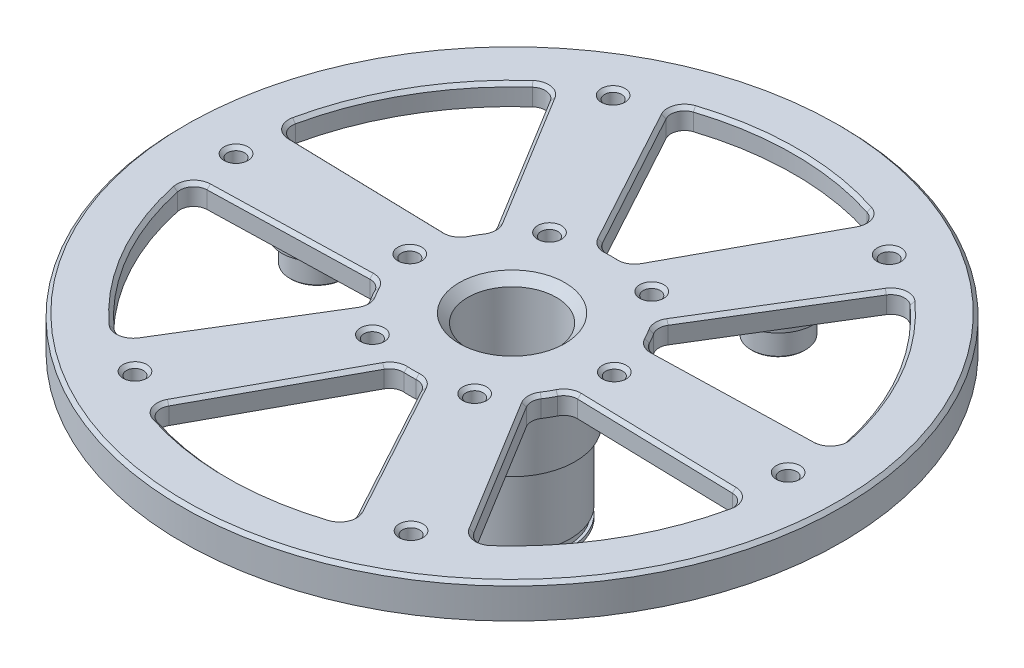
from build123d import *

# Parameters (mm, degrees)
SKETCH2_W                                     = 0.75
SKETCH2_H                                     = 12.25
CIRPATTERN2_COUNT                             = 3
CHAMFER1_SIZE                                 = 1.25
M3X0_5_TAPPED_HOLE_60_MM_DIAMETER_D           = 2.5
M3X0_5_TAPPED_HOLE_60_MM_DIAMETER_CSINK_D     = 3.5
M3X0_5_TAPPED_HOLE_60_MM_DIAMETER_CSINK_ANGLE = 90
CIRPATTERN3_COUNT                             = 6
CUT_EXTRUDE1_DEPTH                            = 72.270295355
CIRPATTERN4_COUNT                             = 6
CHAMFER2_SIZE                                 = 0.5
CHAMFER3_SIZE                                 = 0.5
SKETCH14_W                                    = 6.551993776
SKETCH14_H                                    = 1.1
CHAMFER4_SIZE                                 = 0.5
CHAMFER5_SIZE                                 = 0.2


with BuildPart() as part:
    # Sketch1 → Shaft (revolve)
    with BuildSketch(Plane.XY):
        Polygon((-6.5, 18.1), (-6.5, -1.95), (-4.5, -1.95), (-4.5, -3.95), (-6.6, -3.95), (-6.6, -6.45), (-8.5, -6.45), (-8.5, 18.1), align=None)
    revolve(axis=Axis((0, 0, 0), (0, -1, 0)))

    # Sketch2 → Revolve1 (revolve)
    with BuildSketch(Plane.XY):
        with Locations((-8.875, 11.975)):
            Rectangle(SKETCH2_W, SKETCH2_H)
    revolve(axis=Axis((0, 0, 0), (0, 1, 0)))



with BuildPart() as body_2:
    # Sketch4 → Revolve2 (revolve)
    with BuildSketch(Plane.XY):
        Polygon((-28.599, 12), (-28.599, 18.1), (-33.799, 18.1), (-33.799, 16), (-32.599, 16), (-32.599, 12), align=None)
    revolve(axis=Axis((-28.599, 12.136274552, 0), (0, -1, 0)))


with BuildPart() as cirpattern2_1:
    # CirPattern2: pattern copy
    add(body_2.part.rotate(Axis((0, 0, 0), (0, 1, 0)), 1 * 360 / CIRPATTERN2_COUNT))


with BuildPart() as cirpattern2_2:
    # CirPattern2: pattern copy
    add(body_2.part.rotate(Axis((0, 0, 0), (0, 1, 0)), 2 * 360 / CIRPATTERN2_COUNT))


with BuildPart() as part_1:
    add(part.part)

    add(body_2.part)  # Revolve3 merges body 2

    add(cirpattern2_1.part)  # Revolve3 merges CirPattern2_1

    add(cirpattern2_2.part)  # Revolve3 merges CirPattern2_2
    # Sketch8 → Revolve3 (revolve)
    with BuildSketch(Plane.XY):
        Polygon((-48.35, 20.1), (-6.5, 20.1), (-6.5, 17.1), (-42.519999369, 17.1), (-42.519999369, 18.1), (-47.35, 18.1), (-47.35, 15.15), (-48.35, 15.15), align=None)
    revolve(axis=Axis((0, 0, 0), (0, 1, 0)))

    # Chamfer1
    chamfer1_edges = [part_1.edges().sort_by_distance(p)[0] for p in [
        (6.5, 20.1, 0),
    ]]
    chamfer(chamfer1_edges, length=CHAMFER1_SIZE)

    # M3x0.5 Tapped Hole - 60 mm diameter (through all)
    with Locations(Plane(origin=(0, 20.1, 0), x_dir=(1, 0, 0), z_dir=(0, 1, 0))):
        with Locations((-15, 0), (-40.5, 0)):
            m3x0_5_tapped_hole_60_mm_diameter = CounterSinkHole(M3X0_5_TAPPED_HOLE_60_MM_DIAMETER_D / 2, M3X0_5_TAPPED_HOLE_60_MM_DIAMETER_CSINK_D / 2, counter_sink_angle=M3X0_5_TAPPED_HOLE_60_MM_DIAMETER_CSINK_ANGLE)

    # CirPattern3: M3x0.5 Tapped Hole - 60 mm diameter ×6 about axis
    cirpattern3_axis = Axis((0, 0, 0), (0, 1, 0))
    for i in range(1, CIRPATTERN3_COUNT):
        add(m3x0_5_tapped_hole_60_mm_diameter.rotate(cirpattern3_axis, i * 360 / CIRPATTERN3_COUNT), mode=Mode.SUBTRACT)

    # Sketch13 → Cut-Extrude1 (cut, through all)
    with BuildSketch(Plane(origin=(0, 0, 0), x_dir=(1, 0, 0), z_dir=(0, 1, 0))):
        with BuildLine():
            Line((-13.883389556, -36.479634299), (-2.757092363, -16.015247917))
            ThreePointArc((-2.757092363, -16.015247917), (-1.971072098, -15.222129456), (-0.882352941, -14.974025955))
            ThreePointArc((-0.882352941, -14.974025955), (0, -15), (0.882352941, -14.974025955))
            ThreePointArc((0.882352941, -14.974025955), (1.971072098, -15.222129456), (2.757092363, -16.015247917))
            Line((2.757092363, -16.015247917), (13.883389556, -36.479634299))
            ThreePointArc((13.883389556, -36.479634299), (13.983794699, -38.176368726), (12.742627419, -39.337614906))
            ThreePointArc((12.742627419, -39.337614906), (0, -41.35), (-12.742627419, -39.337614906))
            ThreePointArc((-12.742627419, -39.337614906), (-13.983794699, -38.176368726), (-13.883389556, -36.479634299))
        make_face()
    cut_extrude1 = extrude(amount=CUT_EXTRUDE1_DEPTH, mode=Mode.SUBTRACT)

    # CirPattern4: Cut-Extrude1 ×6 about axis
    cirpattern4_axis = Axis((0, 0, 0), (0, 1, 0))
    for i in range(1, CIRPATTERN4_COUNT):
        add(cut_extrude1.rotate(cirpattern4_axis, i * 360 / CIRPATTERN4_COUNT), mode=Mode.SUBTRACT)

    # Chamfer2
    chamfer2_edges = [part_1.edges().sort_by_distance(p)[0] for p in [
        (-26.891071264, 20.1, 5.918180517),
        (-40.05360249, 20.1, 6.977862912),
        (-14.168286857, 20.1, 5.904066218),
        (-12.990381057, 20.1, 7.5),
        (-26.069807791, 20.1, 31.198505813),
        (-12.197214759, 20.1, 9.318063238),
        (-18.570830304, 20.1, 20.329260591),
        (-8.32024096, 20.1, 26.247441108),
        (-13.983794699, 20.1, 38.176368726),
        (-1.971072098, 20.1, 15.222129456),
        (0, 20.1, 15),
        (13.983794699, 20.1, 38.176368726),
        (1.971072098, 20.1, 15.222129456),
        (8.32024096, 20.1, 26.247441108),
        (18.570830304, 20.1, 20.329260591),
        (26.069807791, 20.1, 31.198505813),
        (12.197214759, 20.1, 9.318063238),
        (12.990381057, 20.1, 7.5),
        (40.05360249, 20.1, 6.977862912),
        (14.168286857, 20.1, 5.904066218),
        (26.891071264, 20.1, 5.918180517),
        (26.891071264, 20.1, -5.918180517),
        (40.05360249, 20.1, -6.977862912),
        (14.168286857, 20.1, -5.904066218),
        (12.990381057, 20.1, -7.5),
        (26.069807791, 20.1, -31.198505813),
        (12.197214759, 20.1, -9.318063238),
        (18.570830304, 20.1, -20.329260591),
        (8.32024096, 20.1, -26.247441108),
        (13.983794699, 20.1, -38.176368726),
        (1.971072098, 20.1, -15.222129456),
        (0, 20.1, -15),
        (-13.983794699, 20.1, -38.176368726),
        (-1.971072098, 20.1, -15.222129456),
        (-8.32024096, 20.1, -26.247441108),
        (-26.891071264, 20.1, -5.918180517),
        (-14.168286857, 20.1, -5.904066218),
        (-40.05360249, 20.1, -6.977862912),
        (-12.990381057, 20.1, -7.5),
        (-12.197214759, 20.1, -9.318063238),
        (-26.069807791, 20.1, -31.198505813),
        (-18.570830304, 20.1, -20.329260591),
        (-35.810150446, 20.1, 20.675),
        (0, 20.1, 41.35),
        (35.810150446, 20.1, 20.675),
        (35.810150446, 20.1, -20.675),
        (0, 20.1, -41.35),
        (-35.810150446, 20.1, -20.675),
    ]]
    chamfer(chamfer2_edges, length=CHAMFER2_SIZE)

    # Chamfer3
    chamfer3_edges = [part_1.edges().sort_by_distance(p)[0] for p in [
        (48.35, 20.1, 0),
    ]]
    chamfer(chamfer3_edges, length=CHAMFER3_SIZE)

    # Sketch14 → Cut-Revolve1 (revolve, cut)
    with BuildSketch(Plane.XY):
        with Locations((-11.375996888, -4.9)):
            Rectangle(SKETCH14_W, SKETCH14_H)
    revolve(axis=Axis((0, 0, 0), (0, -1, 0)), mode=Mode.SUBTRACT)

    # Chamfer4
    chamfer4_edges = [part_1.edges().sort_by_distance(p)[0] for p in [
        (8.5, -6.45, 0),
    ]]
    chamfer(chamfer4_edges, length=CHAMFER4_SIZE)

    # Chamfer5
    chamfer5_edges = [part_1.edges().sort_by_distance(p)[0] for p in [
        (12.2995, 12, -21.303358908),
        (12.2995, 12, 21.303358908),
        (-24.599, 12, 0),
    ]]
    chamfer(chamfer5_edges, length=CHAMFER5_SIZE)


solid = part_1.part
